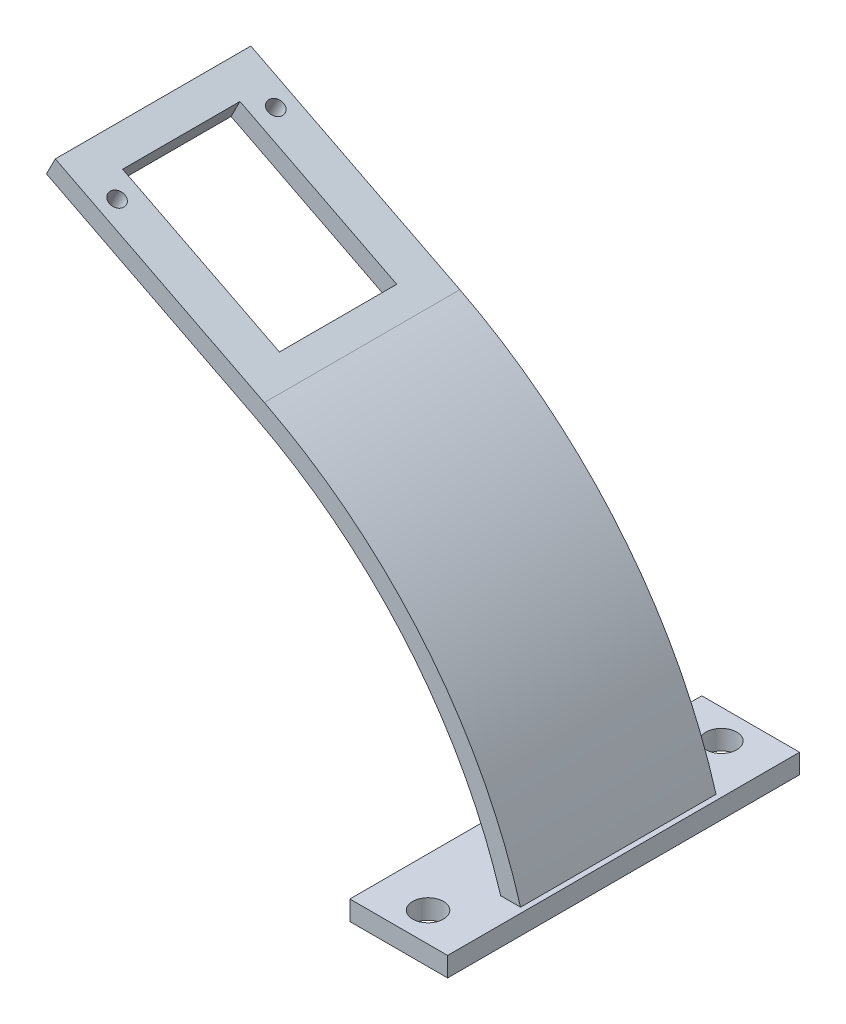
from build123d import *

# Parameters (mm, degrees)
BOSS_EXTRUDE1_DEPTH = 25.4
CUT_EXTRUDE1_REACH  = 84.87
SKETCH2_R           = 0.99949
SKETCH2_W           = 22.86
SKETCH2_H           = 15.24
SKETCH3_W           = 12.7
SKETCH3_H           = 45.72
SKETCH3_R           = 2
BOSS_EXTRUDE2_DEPTH = 2.54


with BuildPart() as part:
    # Sketch1 → Boss-Extrude1 (new body)
    with BuildSketch(Plane.XY):
        with BuildLine():
            Line((-32.578270726, 40.408843429), (-59.736149583, 54.246473861))
            Line((-59.736149583, 54.246473861), (-58.583013714, 56.509630432))
            Line((-58.583013714, 56.509630432), (-31.425134857, 42.672))
            ThreePointArc((-31.425134857, 42.672), (-9.813641153, 25.020432537), (2.54, 0))
            Line((2.54, 0), (0, 0))
            ThreePointArc((0, 0), (-11.97175713, 23.685162685), (-32.578270726, 40.408843429))
        make_face()
    extrude(amount=BOSS_EXTRUDE1_DEPTH)

    # Sketch2 → Cut-Extrude1 (cut, up to next)
    with BuildSketch(Plane(origin=(10.784234574, 21.165252068, 0), x_dir=(0.8910065241883675, -0.45399049973954775, 0), z_dir=(0.45399049973954775, 0.8910065241883675, 0)), mode=Mode.PRIVATE) as cut_extrude1_sk1:
        with Locations((-71.502682786, -2.41681)):
            Circle(SKETCH2_R)
    cut_extrude1_tool1 = extrude(cut_extrude1_sk1.sketch, amount=-CUT_EXTRUDE1_REACH, mode=Mode.PRIVATE) & part.part
    # Sketch2 → Cut-Extrude1 (cut, up to next)
    with BuildSketch(Plane(origin=(10.784234574, 21.165252068, 0), x_dir=(0.8910065241883675, -0.45399049973954775, 0), z_dir=(0.45399049973954775, 0.8910065241883675, 0)), mode=Mode.PRIVATE) as cut_extrude1_sk2:
        with Locations((-71.502682786, -23.03399)):
            Circle(SKETCH2_R)
    cut_extrude1_tool2 = extrude(cut_extrude1_sk2.sketch, amount=-CUT_EXTRUDE1_REACH, mode=Mode.PRIVATE) & part.part
    # Sketch2 → Cut-Extrude1 (cut, up to next)
    with BuildSketch(Plane(origin=(10.784234574, 21.165252068, 0), x_dir=(0.8910065241883675, -0.45399049973954775, 0), z_dir=(0.45399049973954775, 0.8910065241883675, 0)), mode=Mode.PRIVATE) as cut_extrude1_sk3:
        with Locations((-62.307882786, -12.7)):
            Rectangle(SKETCH2_W, SKETCH2_H)
    cut_extrude1_tool3 = extrude(cut_extrude1_sk3.sketch, amount=-CUT_EXTRUDE1_REACH, mode=Mode.PRIVATE) & part.part
    add(cut_extrude1_tool1.solids().sort_by_distance((-52.925122, 53.626791, 2.41681))[0], mode=Mode.SUBTRACT)
    add(cut_extrude1_tool2.solids().sort_by_distance((-52.925122, 53.626791, 23.03399))[0], mode=Mode.SUBTRACT)
    add(cut_extrude1_tool3.solids().sort_by_distance((-44.732495, 49.452439, 12.7))[0], mode=Mode.SUBTRACT)

    # Sketch3 → Boss-Extrude2 (add)
    with BuildSketch(Plane(origin=(0, 0, 0), x_dir=(1, 0, 0), z_dir=(0, 1, 0))):
        with Locations((-3.81, -12.7)):
            Rectangle(SKETCH3_W, SKETCH3_H)
        with Locations((-3.81, 6.35)):
            Circle(SKETCH3_R, mode=Mode.SUBTRACT)
        with Locations((-3.81, -31.75)):
            Circle(SKETCH3_R, mode=Mode.SUBTRACT)
    extrude(amount=BOSS_EXTRUDE2_DEPTH)


solid = part.part
